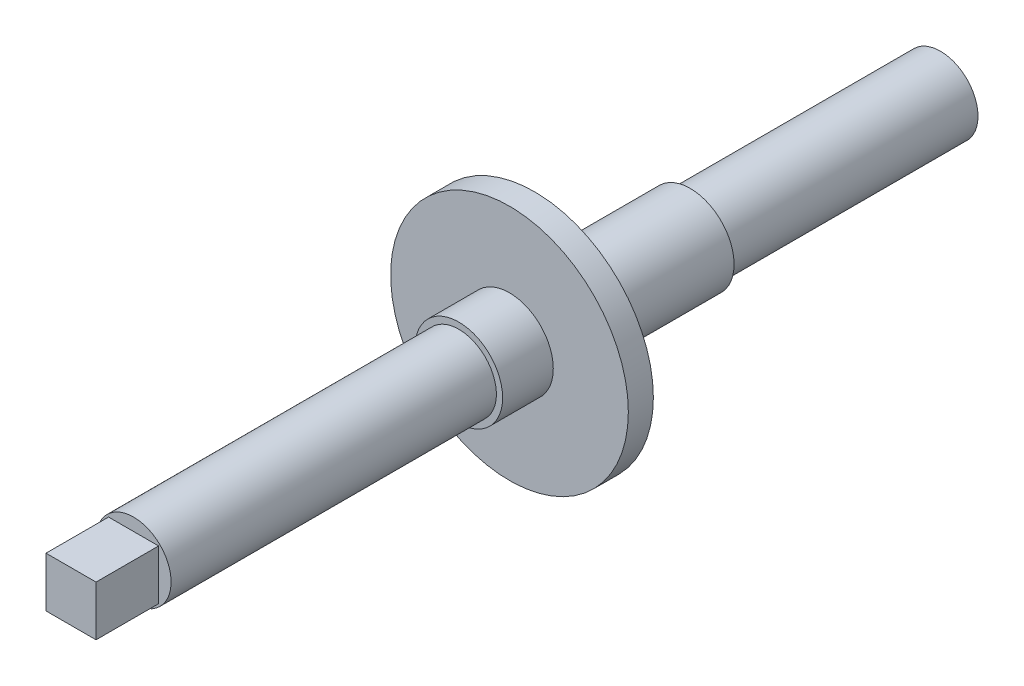
from build123d import *

# Parameters (mm, degrees)
CROQUIS1_R              = 3
SALIENTE_EXTRUIR1_DEPTH = 20
CROQUIS2_R              = 3.5
SALIENTE_EXTRUIR2_DEPTH = 12.45
CROQUIS3_R              = 9.5
SALIENTE_EXTRUIR3_DEPTH = 2
CROQUIS4_R              = 3.5
SALIENTE_EXTRUIR4_DEPTH = 4.05
CROQUIS5_R              = 3
SALIENTE_EXTRUIR5_DEPTH = 26
CROQUIS6_W              = 4
CROQUIS6_H              = 4
SALIENTE_EXTRUIR6_DEPTH = 5


with BuildPart() as part:
    # Croquis1 → Saliente-Extruir1 (new body)
    with BuildSketch(Plane.XY):
        Circle(CROQUIS1_R)
    extrude(amount=SALIENTE_EXTRUIR1_DEPTH)

    # Croquis2 → Saliente-Extruir2 (add)
    with BuildSketch(Plane.XY.offset(20)):
        Circle(CROQUIS2_R)
    extrude(amount=SALIENTE_EXTRUIR2_DEPTH)

    # Croquis3 → Saliente-Extruir3 (add)
    with BuildSketch(Plane.XY.offset(32.45)):
        Circle(CROQUIS3_R)
    extrude(amount=SALIENTE_EXTRUIR3_DEPTH)

    # Croquis4 → Saliente-Extruir4 (add)
    with BuildSketch(Plane.XY.offset(34.45)):
        Circle(CROQUIS4_R)
    extrude(amount=SALIENTE_EXTRUIR4_DEPTH)

    # Croquis5 → Saliente-Extruir5 (add)
    with BuildSketch(Plane.XY.offset(38.5)):
        Circle(CROQUIS5_R)
    extrude(amount=SALIENTE_EXTRUIR5_DEPTH)

    # Croquis6 → Saliente-Extruir6 (add)
    with BuildSketch(Plane.XY.offset(64.5)):
        Rectangle(CROQUIS6_W, CROQUIS6_H)
    extrude(amount=SALIENTE_EXTRUIR6_DEPTH)


solid = part.part
